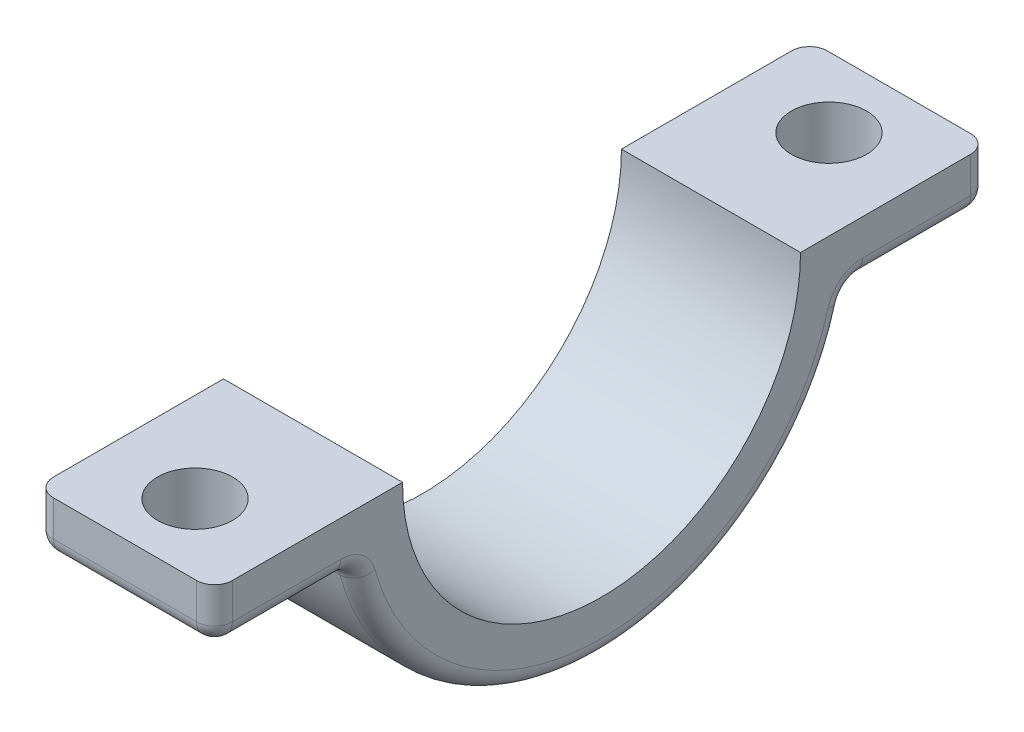
from build123d import *

# Parameters (mm, degrees)
CLAMP_EXTRUDE_DEPTH     = 10
HOLE_R                  = 2.1
HOLES_CUT_EXTRUDE_DEPTH = 27.279037511
FILLET1_R               = 1


with BuildPart() as part:
    # Sketch4 → Clamp Extrude (new body)
    with BuildSketch(Plane(origin=(0, 0, 0), x_dir=(0, 0, -1), z_dir=(1, 0, 0))):
        with BuildLine():
            Line((-21.6125, 0), (-11.1125, 0))
            ThreePointArc((-11.1125, 0), (0, -11.1125), (11.1125, 0))
            Line((11.1125, 0), (21.6125, 0))
            Line((21.6125, 0), (21.6125, -3))
            Line((21.6125, -3), (13.789947652, -3))
            ThreePointArc((13.789947652, -3), (0, -14.1125), (-13.789947652, -3))
            Line((-13.789947652, -3), (-21.6125, -3))
            Line((-21.6125, -3), (-21.6125, 0))
        make_face()
    extrude(amount=CLAMP_EXTRUDE_DEPTH)

    # Hole → Holes Cut-Extrude (cut, through all)
    with BuildSketch(Plane.XZ.offset(3)):
        with Locations((5, 17.701223826)):
            Circle(HOLE_R)
        with Locations((5, -17.701223826)):
            Circle(HOLE_R)
    extrude(amount=-HOLES_CUT_EXTRUDE_DEPTH, mode=Mode.SUBTRACT)

    # Fillet1
    fillet1_edges = [part.edges().sort_by_distance(p)[0] for p in [
        (10, -3, -17.701223826),
        (0, -3, -17.701223826),
        (10, -14.1125, 0),
        (0, -14.1125, 0),
        (0, -1.5, 21.6125),
        (10, -1.5, 21.6125),
        (10, -1.5, -21.6125),
        (0, -1.5, -21.6125),
        (5, -3, -21.6125),
        (5, -3, -13.789947652),
        (5, -3, 13.789947652),
        (10, -3, 17.701223826),
        (5, -3, 21.6125),
        (0, -3, 17.701223826),
    ]]
    fillet(fillet1_edges, radius=FILLET1_R)


solid = part.part
